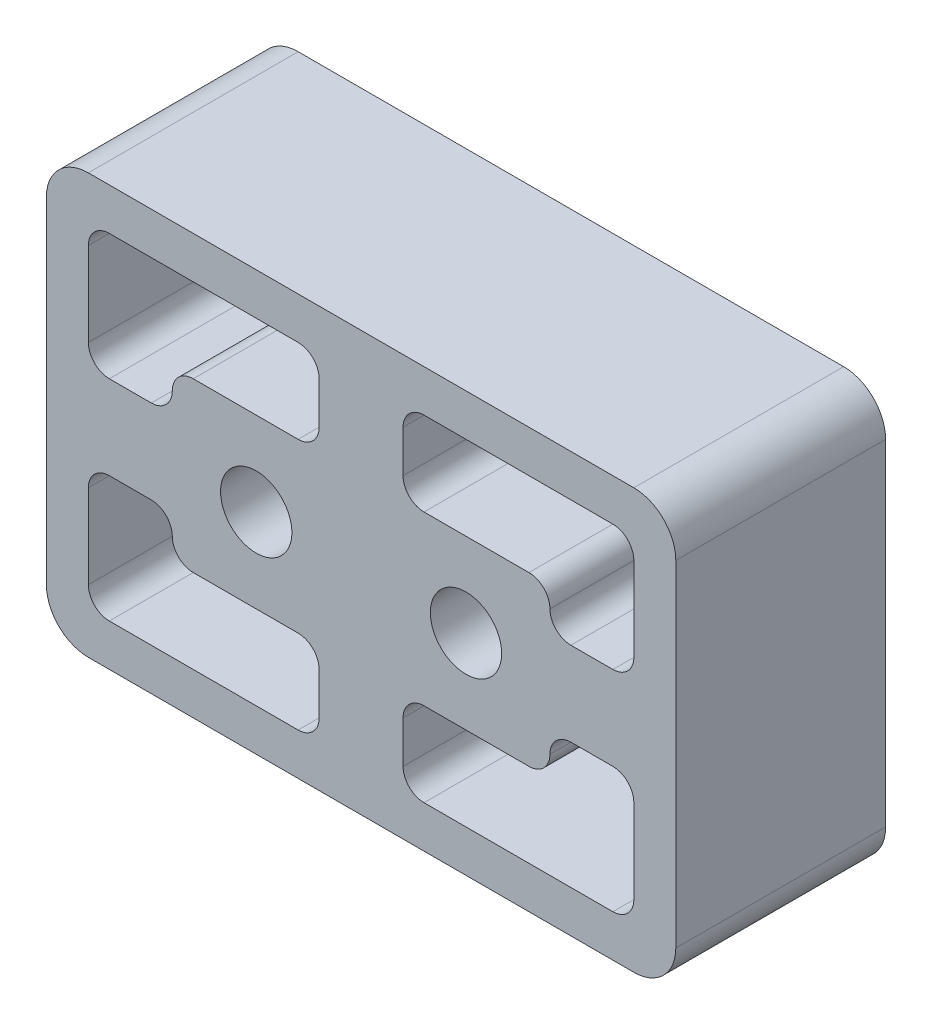
from build123d import *

# Parameters (mm, degrees)
SKETCH_1_W          = 30
SKETCH_1_H          = 20
EXTRUDE_1_DEPTH     = 10
FILLET_1_R          = 2
SKETCH_2_R          = 1.7
CUT_EXTRUDE_1_DEPTH = 21.615528128
CUT_EXTRUDE_2_DEPTH = 21.615528128
FILLET_2_R          = 1


with BuildPart() as part:
    # 草图1 → 凸台-拉伸1 (new body)
    with BuildSketch(Plane.XY):
        Rectangle(SKETCH_1_W, SKETCH_1_H)
    extrude(amount=EXTRUDE_1_DEPTH)

    # 圆角1
    fillet_1_edges = [part.edges().sort_by_distance(p)[0] for p in [
        (15, -10, 5),
        (-15, -10, 5),
        (-15, 10, 5),
        (15, 10, 5),
    ]]
    fillet(fillet_1_edges, radius=FILLET_1_R)

    # 草图2 → 切除-拉伸1 (cut, through all)
    with BuildSketch(Plane.XY.offset(10)):
        with Locations((5, 0)):
            Circle(SKETCH_2_R)
        with Locations(Location((-5, 0, 0), (0, 0, 180))):
            Circle(SKETCH_2_R)
    extrude(amount=-CUT_EXTRUDE_1_DEPTH, mode=Mode.SUBTRACT)

    # 草图3 → 切除-拉伸2 (cut, through all)
    with BuildSketch(Plane.XY.offset(10)):
        Polygon((-13, 2), (-13, 8), (-2, 8), (-2, 4), (-9, 4), (-9, 2), align=None)
        Polygon((9, 2), (13, 2), (13, 8), (2, 8), (2, 4), (9, 4), align=None)
        Polygon((13, -2), (13, -8), (2, -8), (2, -4), (9, -4), (9, -2), align=None)
        Polygon((-9, -2), (-13, -2), (-13, -8), (-2, -8), (-2, -4), (-9, -4), align=None)
    extrude(amount=-CUT_EXTRUDE_2_DEPTH, mode=Mode.SUBTRACT)

    # 圆角2
    fillet_2_edges = [part.edges().sort_by_distance(p)[0] for p in [
        (-2, -4, 5),
        (2, 8, 5),
        (13, 8, 5),
        (13, 2, 5),
        (2, 4, 5),
        (9, 2, 5),
        (9, 4, 5),
        (13, -2, 5),
        (2, -8, 5),
        (2, -4, 5),
        (9, -2, 5),
        (9, -4, 5),
        (13, -8, 5),
        (-2, -8, 5),
        (-13, -8, 5),
        (-13, -2, 5),
        (-9, -2, 5),
        (-9, -4, 5),
        (-2, 8, 5),
        (-2, 4, 5),
        (-9, 4, 5),
        (-9, 2, 5),
        (-13, 2, 5),
        (-13, 8, 5),
    ]]
    fillet(fillet_2_edges, radius=FILLET_2_R - 0.0001)  # a hair under: the kernel refuses the full size


solid = part.part
